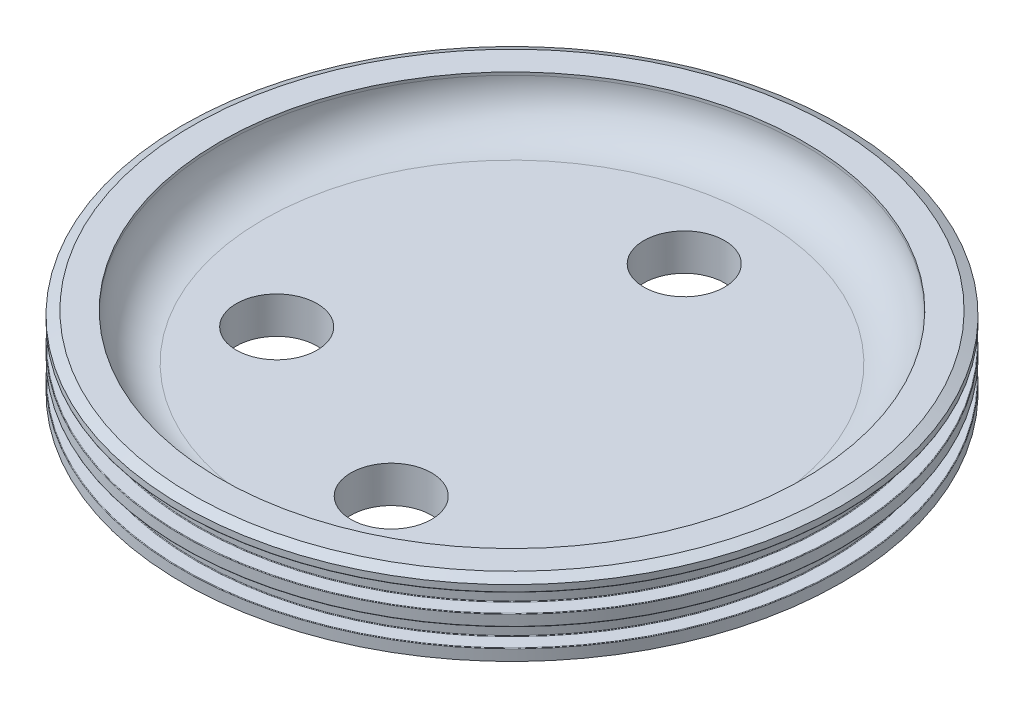
from build123d import *

# Parameters (mm, degrees)
SKETCH6_R                                = 66.04
BOSS_EXTRUDE1_DEPTH                      = 2.54
CNC_ID_FILLET_R                          = 0.127
CNC_OD_FILLET_R                          = 0.127
CNC_CHAMFERS_SIZE                        = 1.016
CNC_CHAMFERS_SIZE2                       = 2.178819031
PIPE_TAP_DRILL_FOR_1_2_TAP_FILL_VALVE_D  = 17.8562
PIPE_TAP_DRILL_FOR_1_4_TAP_SOLENOID_VA_D = 17.8562
PIPE_TAP_DRILL_FOR_1_2_TAP_CRYO_VALVE_D  = 17.8562
FILLET1_R                                = 9.525


with BuildPart() as part:
    # Sketch1 → Revolve1 (revolve)
    with BuildSketch(Plane.XY):
        Polygon((0, 0), (72.898, 0), (72.898, 2.54), (69.6468, 2.54), (69.6468, 6.604), (72.898, 6.604), (72.898, 9.144), (69.6468, 9.144), (69.6468, 13.208), (72.898, 13.208), (72.898, 15.748), (64.5668, 15.748), (64.5668, 5.588), (0, 5.588), align=None)
    revolve(axis=Axis((0, 48.192213231, 0), (0, -1, 0)))

    # Sketch6 → Boss-Extrude1 (add)
    with BuildSketch(Plane.XZ):
        Circle(SKETCH6_R)
    extrude(amount=BOSS_EXTRUDE1_DEPTH)

    # CNC ID Fillet
    cnc_id_fillet_edges = [part.edges().sort_by_distance(p)[0] for p in [
        (-69.6468, 6.604, 0),
        (-69.6468, 2.54, 0),
        (-66.04, 0, 0),
        (-69.6468, 13.208, 0),
        (-69.6468, 9.144, 0),
    ]]
    fillet(cnc_id_fillet_edges, radius=CNC_ID_FILLET_R)

    # CNC OD Fillet
    cnc_od_fillet_edges = [part.edges().sort_by_distance(p)[0] for p in [
        (-72.898, 6.604, 0),
        (-72.898, 2.54, 0),
        (-72.898, 9.144, 0),
        (-72.898, 13.208, 0),
        (-66.04, -2.54, 0),
    ]]
    fillet(cnc_od_fillet_edges, radius=CNC_OD_FILLET_R)

    # CNC Chamfers
    cnc_chamfers_edges = [part.edges().sort_by_distance(p)[0] for p in [
        (-72.898, 15.748, 0),
    ]]
    cnc_chamfers_side = [part.faces().sort_by_distance(p)[0] for p in [
        (-72.898, 14.5415, 0),
    ]]
    chamfer(cnc_chamfers_edges, length=CNC_CHAMFERS_SIZE, length2=CNC_CHAMFERS_SIZE2, reference=cnc_chamfers_side[0])

    # Pipe Tap Drill for 1/2 Tap - Fill Valve (through all)
    with Locations(Plane(origin=(0, -2.54, 0), x_dir=(-1, 0, 0), z_dir=(0, -1, 0))):
        with Locations((0, 38.1)):
            Hole(PIPE_TAP_DRILL_FOR_1_2_TAP_FILL_VALVE_D / 2)

    # Pipe Tap Drill for 1/4 Tap - Solenoid Valve (through all)
    with Locations(Plane(origin=(0, -2.54, 0), x_dir=(-1, 0, 0), z_dir=(0, -1, 0))):
        with Locations((-12.089248859, -38.800253376)):
            Hole(PIPE_TAP_DRILL_FOR_1_4_TAP_SOLENOID_VA_D / 2)

    # Pipe Tap Drill for 1/2 Tap - Cryo Valve (through all)
    with Locations(Plane(origin=(0, -2.54, 0), x_dir=(-1, 0, 0), z_dir=(0, -1, 0))):
        with Locations((32.995567884, -19.05)):
            Hole(PIPE_TAP_DRILL_FOR_1_2_TAP_CRYO_VALVE_D / 2)

    # Fillet1
    fillet1_edges = [part.edges().sort_by_distance(p)[0] for p in [
        (-64.5668, 5.588, 0),
    ]]
    fillet(fillet1_edges, radius=FILLET1_R)


solid = part.part
